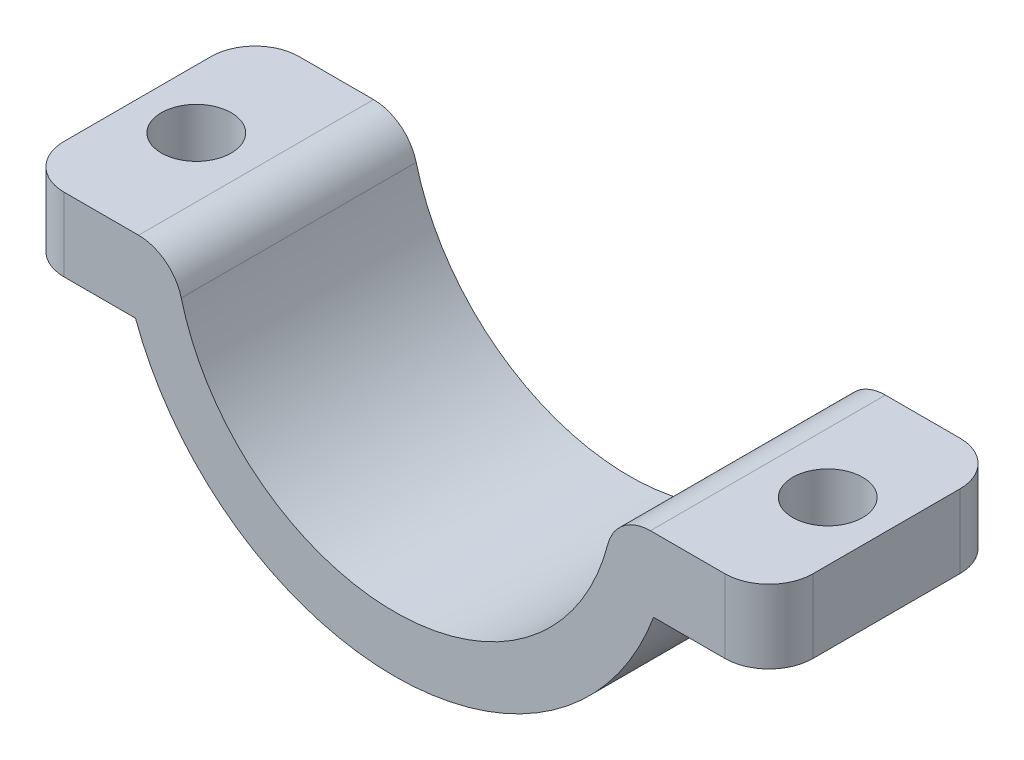
from build123d import *

# Parameters (mm, degrees)
SALIENTE_EXTRUIR1_DEPTH = 8
CROQUIS2_R              = 2.38125
CORTAR_EXTRUIR1_DEPTH   = 16
REDONDEO1_R             = 3


with BuildPart() as part:
    # Croquis1 → Saliente-Extruir1 (new, symmetric)
    with BuildSketch(Plane.XY):
        with BuildLine():
            Line((-14.924811557, -1.5), (-25.5, -1.5))
            Line((-25.5, -1.5), (-25.5, -6.5))
            Line((-25.5, -6.5), (-17.640578222, -6.5))
            ThreePointArc((-17.640578222, -6.5), (0, -18.8), (17.640578222, -6.5))
            Line((17.640578222, -6.5), (25.5, -6.5))
            Line((25.5, -6.5), (25.5, -1.5))
            Line((25.5, -1.5), (14.924811557, -1.5))
            ThreePointArc((14.924811557, -1.5), (0, -15), (-14.924811557, -1.5))
        make_face()
    extrude(amount=SALIENTE_EXTRUIR1_DEPTH, both=True)

    # Croquis2 → Cortar-Extruir1 (cut)
    with BuildSketch(Plane(origin=(0, -1.5, 0), x_dir=(1, 0, 0), z_dir=(0, 1, 0))):
        with Locations((-21.5, 0)):
            Circle(CROQUIS2_R)
        with Locations((21.5, 0)):
            Circle(CROQUIS2_R)
    extrude(amount=-CORTAR_EXTRUIR1_DEPTH, mode=Mode.SUBTRACT)

    # Redondeo1
    redondeo1_edges = [part.edges().sort_by_distance(p)[0] for p in [
        (14.924811557, -1.5, 0),
        (-14.924811557, -1.5, 0),
        (-25.5, -4, 8),
        (-25.5, -4, -8),
        (25.5, -4, -8),
        (25.5, -4, 8),
    ]]
    fillet(redondeo1_edges, radius=REDONDEO1_R)


solid = part.part
